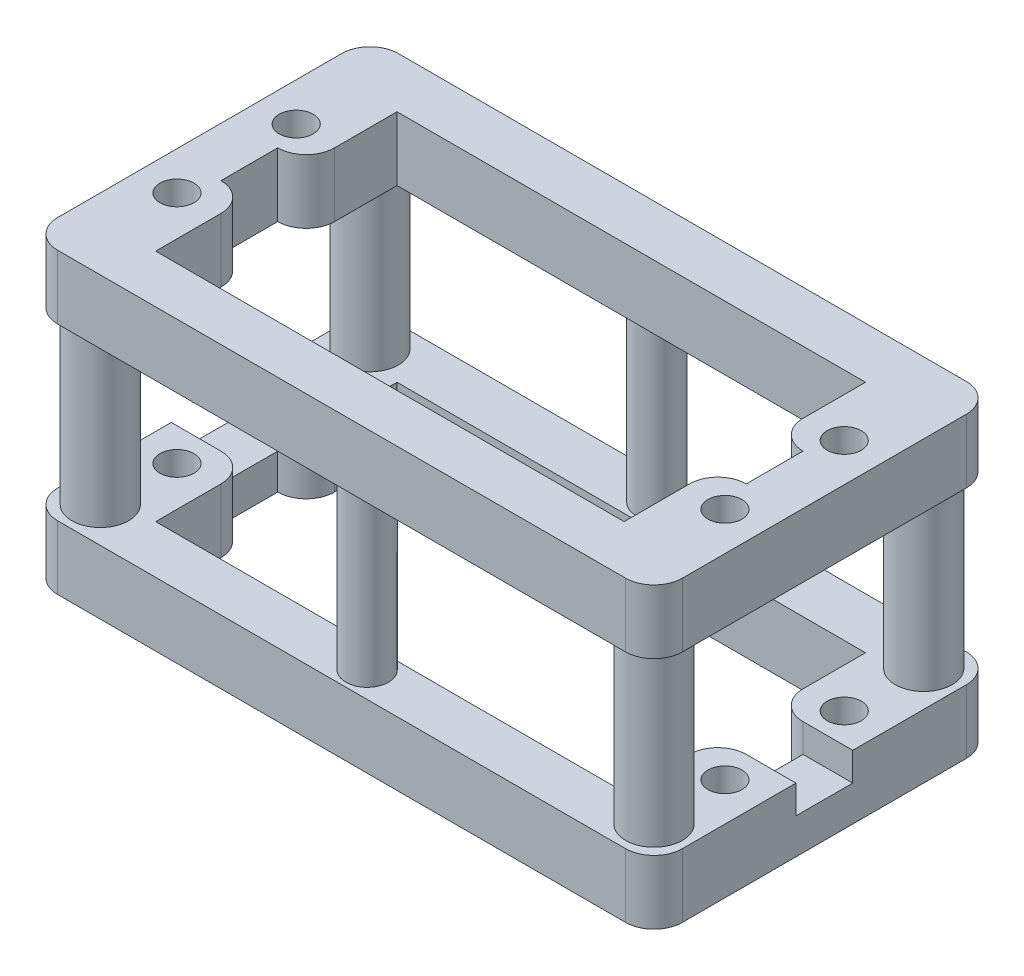
from build123d import *

# Parameters (mm, degrees)
SKETCH1_W           = 55.88
SKETCH1_H           = 30.48
BOSS_EXTRUDE1_DEPTH = 13.335
CUT_EXTRUDE1_DEPTH  = 26.67
CUT_EXTRUDE2_REACH  = 45.445
SKETCH3_W           = 55.88
SKETCH3_H           = 15.24
SKETCH6_R           = 2.54
SKETCH6_R_2         = 1.905
BOSS_EXTRUDE4_DEPTH = 15.24
FILLET1_R           = 2.54
FILLET2_R           = 2.54
CUT_EXTRUDE4_START  = -26.67
SKETCH8_R           = 1.524
CUT_EXTRUDE4_DEPTH  = 26.67
SKETCH9_W           = 4.445
SKETCH9_H           = 5.08
CUT_EXTRUDE5_DEPTH  = 2.54


with BuildPart() as part:
    # Sketch1 → Boss-Extrude1 (new, symmetric)
    with BuildSketch(Plane(origin=(0, 0, 0), x_dir=(1, 0, 0), z_dir=(0, 1, 0))):
        Rectangle(SKETCH1_W, SKETCH1_H)
    extrude(amount=BOSS_EXTRUDE1_DEPTH, both=True)

    # Sketch2 → Cut-Extrude1 (cut)
    with BuildSketch(Plane(origin=(0, 13.335, 0), x_dir=(1, 0, 0), z_dir=(0, 1, 0))):
        Polygon((-20.955, -10.922), (20.955, -10.922), (20.955, -2.54), (23.495, -2.54), (23.495, 2.54), (20.955, 2.54), (20.955, 10.668), (-20.955, 10.668), (-20.955, 2.54), (-23.495, 2.54), (-23.495, -2.54), (-20.955, -2.54), align=None)
    extrude(amount=-CUT_EXTRUDE1_DEPTH, mode=Mode.SUBTRACT)

    # Cut-Extrude2: up to this face of the body (flat: up to its plane)
    cut_extrude2_end = Plane(part.part.faces().sort_by_distance((0, 0, -15.24))[0])
    # Sketch3 → Cut-Extrude2 (cut, up to the picked face)
    with BuildSketch(Plane.XY.offset(15.24), mode=Mode.PRIVATE) as cut_extrude2_sk1:
        Rectangle(SKETCH3_W, SKETCH3_H)
    cut_extrude2_tool1 = split(extrude(cut_extrude2_sk1.sketch, amount=-CUT_EXTRUDE2_REACH, mode=Mode.PRIVATE), bisect_by=cut_extrude2_end, keep=Keep.BOTH, mode=Mode.PRIVATE)
    add(cut_extrude2_tool1.solids().sort_by(Axis((0, 0, 15.24), (0, 0, -1)))[0], mode=Mode.SUBTRACT)


with BuildPart() as cut_extrude2_piece_1:
    # of the separate pieces the step leaves, piece 1, a body of its own (cut_extrude2_pieces)
    add(part.part.solids().sort_by_distance((-27.94, -7.62, 15.24))[0])



with BuildPart() as cut_extrude2_piece_2:
    # of the separate pieces the step leaves, piece 2, a body of its own (cut_extrude2_pieces)
    add(part.part.solids().sort_by_distance((-27.94, 13.335, 15.24))[0])


with BuildPart() as cut_extrude2_piece_1_1:
    add(cut_extrude2_piece_1.part)

    add(cut_extrude2_piece_2.part)  # Boss-Extrude4 merges Cut-Extrude2 piece 2
    # Sketch6 → Boss-Extrude4 (add)
    with BuildSketch(Plane(origin=(0, -7.62, 0), x_dir=(1, 0, 0), z_dir=(0, 1, 0))):
        with Locations(Location((-24.765, -12.065, 0), (0, 0, 90))):
            Circle(SKETCH6_R)
        with Locations(Location((24.765, -12.065, 0), (0, 0, 90))):
            Circle(SKETCH6_R)
        with Locations(Location((-24.765, 12.065, 0), (0, 0, 90))):
            Circle(SKETCH6_R)
        with Locations(Location((24.765, 12.065, 0), (0, 0, 90))):
            Circle(SKETCH6_R)
        with Locations(Location((0, -12.954, 0), (0, 0, 90))):
            Circle(SKETCH6_R_2)
        with Locations(Location((0, 12.954, 0), (0, 0, 90))):
            Circle(SKETCH6_R_2)
    extrude(amount=BOSS_EXTRUDE4_DEPTH)

    # Fillet1
    fillet1_edges = [cut_extrude2_piece_1_1.edges().sort_by_distance(p)[0] for p in [
        (-27.94, 10.4775, -15.24),
        (-27.94, 10.4775, 15.24),
        (27.94, 10.4775, 15.24),
        (27.94, 10.4775, -15.24),
        (27.94, -10.4775, -15.24),
        (27.94, -10.4775, 15.24),
        (-27.94, -10.4775, 15.24),
        (-27.94, -10.4775, -15.24),
    ]]
    fillet(fillet1_edges, radius=FILLET1_R)

    # Fillet2
    fillet2_edges = [cut_extrude2_piece_1_1.edges().sort_by_distance(p)[0] for p in [
        (20.955, 10.4775, 2.54),
        (20.955, 10.4775, -2.54),
        (-20.955, 10.4775, 2.54),
        (-20.955, 10.4775, -2.54),
        (20.955, -10.4775, 2.54),
        (20.955, -10.4775, -2.54),
        (-20.955, -10.4775, 2.54),
        (-20.955, -10.4775, -2.54),
    ]]
    fillet(fillet2_edges, radius=FILLET2_R - 0.0001)  # a hair under: the kernel refuses the full size

    # Sketch8 → Cut-Extrude4 (cut)
    with BuildSketch(Plane(origin=(0, 13.335, 0), x_dir=(1, 0, 0), z_dir=(0, 1, 0)).offset(CUT_EXTRUDE4_START)):
        with Locations(Location((-24.511, 5.207, 0), (0, 0, 270))):
            Circle(SKETCH8_R)
        with Locations(Location((-24.511, -5.461, 0), (0, 0, 270))):
            Circle(SKETCH8_R)
        with Locations(Location((24.511, 5.207, 0), (0, 0, 270))):
            Circle(SKETCH8_R)
        with Locations(Location((24.511, -5.461, 0), (0, 0, 270))):
            Circle(SKETCH8_R)
    extrude(amount=CUT_EXTRUDE4_DEPTH, mode=Mode.SUBTRACT)

    # Sketch9 → Cut-Extrude5 (cut)
    with BuildSketch(Plane(origin=(0, -7.62, 0), x_dir=(1, 0, 0), z_dir=(0, 1, 0))):
        with Locations((-25.7175, 0)):
            Rectangle(SKETCH9_W, SKETCH9_H)
        with Locations((25.7175, 0)):
            Rectangle(SKETCH9_W, SKETCH9_H)
    extrude(amount=-CUT_EXTRUDE5_DEPTH, mode=Mode.SUBTRACT)


solid = cut_extrude2_piece_1_1.part
